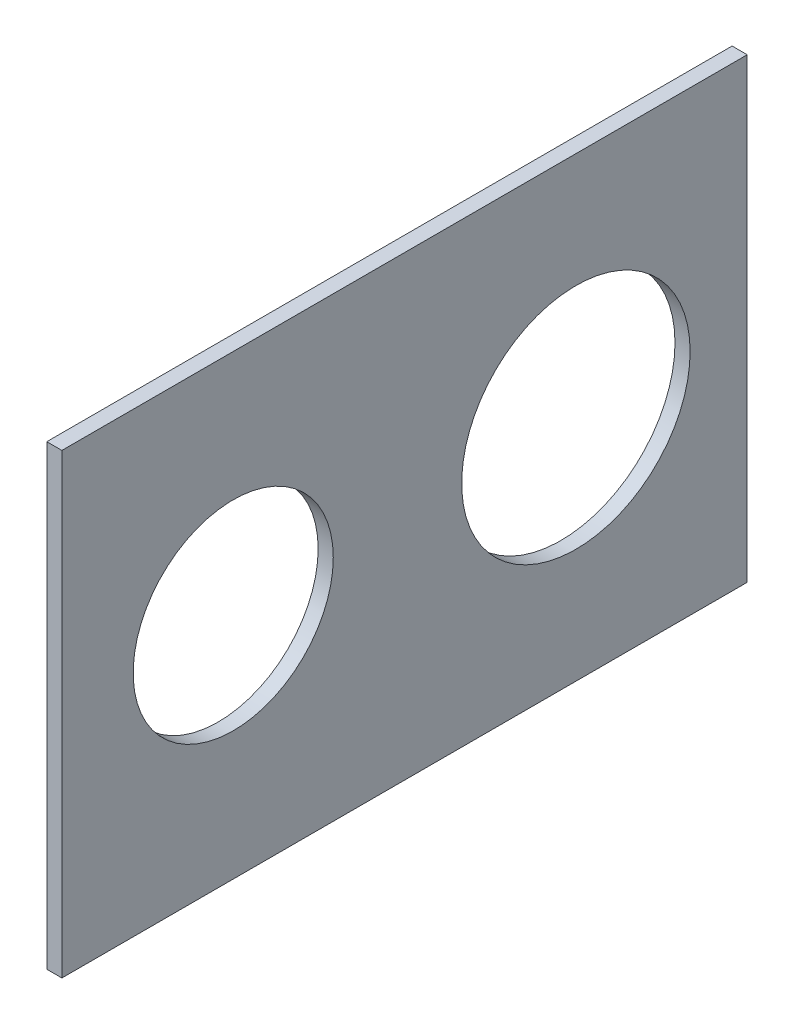
from build123d import *

# Parameters (mm, degrees)
SKETCH1_W           = 50.8
SKETCH1_H           = 76.2
BOSS_EXTRUDE1_DEPTH = 1.681219215
SKETCH3_R           = 11.1252
SKETCH3_R_2         = 12.7
CUT_EXTRUDE1_DEPTH  = 92.59643278


with BuildPart() as part:
    # Sketch1 → Boss-Extrude1 (new body)
    with BuildSketch(Plane.YZ):
        with Locations((25.4, 38.1)):
            Rectangle(SKETCH1_W, SKETCH1_H)
    extrude(amount=BOSS_EXTRUDE1_DEPTH)

    # Sketch3 → Cut-Extrude1 (cut, through all)
    with BuildSketch(Plane.YZ.offset(1.681219215)):
        with Locations((25.4, 57.15)):
            Circle(SKETCH3_R)
        with Locations((25.4, 19.05)):
            Circle(SKETCH3_R_2)
    extrude(amount=-CUT_EXTRUDE1_DEPTH, mode=Mode.SUBTRACT)


solid = part.part
